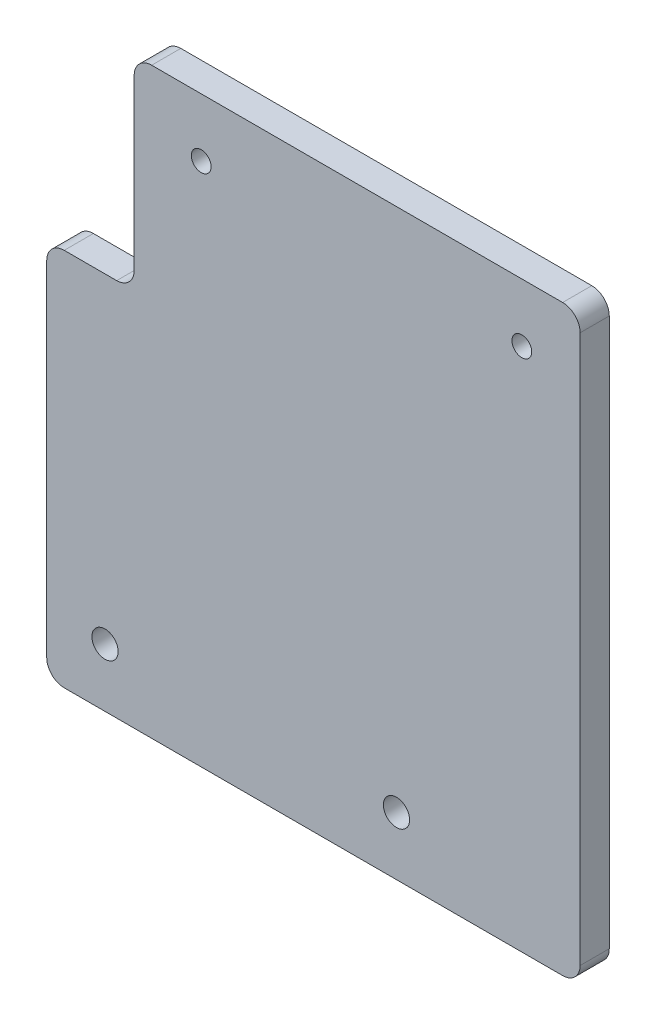
from build123d import *

# Parameters (mm, degrees)
SKETCH1_W            = 91.5
SKETCH1_H            = 100
BOSS_EXTRUDE1_DEPTH  = 5
M4_CLEARANCE_HOLE1_D = 4.5
M3_CLEARANCE_HOLE1_D = 3.4
SKETCH6_W            = 15
SKETCH6_H            = 35
CUT_EXTRUDE1_DEPTH   = 107.382564361
FILLET1_R            = 3


with BuildPart() as part:
    # Sketch1 → Boss-Extrude1 (new body)
    with BuildSketch(Plane.XY):
        with Locations((10.75, 40)):
            Rectangle(SKETCH1_W, SKETCH1_H)
    extrude(amount=BOSS_EXTRUDE1_DEPTH)

    # M4 Clearance Hole1 (through all)
    with Locations(Plane.XY.offset(5)):
        with Locations((-25, 0), (25, 0)):
            Hole(M4_CLEARANCE_HOLE1_D / 2)

    # M3 Clearance Hole1 (through all)
    with Locations(Plane.XY.offset(5)):
        with Locations((-8.5, 80), (46.5, 80)):
            Hole(M3_CLEARANCE_HOLE1_D / 2)

    # Sketch6 → Cut-Extrude1 (cut, through all)
    with BuildSketch(Plane.XY.offset(5)):
        with Locations((-27.5, 72.5)):
            Rectangle(SKETCH6_W, SKETCH6_H)
    extrude(amount=-CUT_EXTRUDE1_DEPTH, mode=Mode.SUBTRACT)

    # Fillet1
    fillet1_edges = [part.edges().sort_by_distance(p)[0] for p in [
        (56.5, 90, 2.5),
        (56.5, -10, 2.5),
        (-35, -10, 2.5),
        (-20, 90, 2.5),
        (-20, 55, 2.5),
        (-35, 55, 2.5),
    ]]
    fillet(fillet1_edges, radius=FILLET1_R)


solid = part.part
